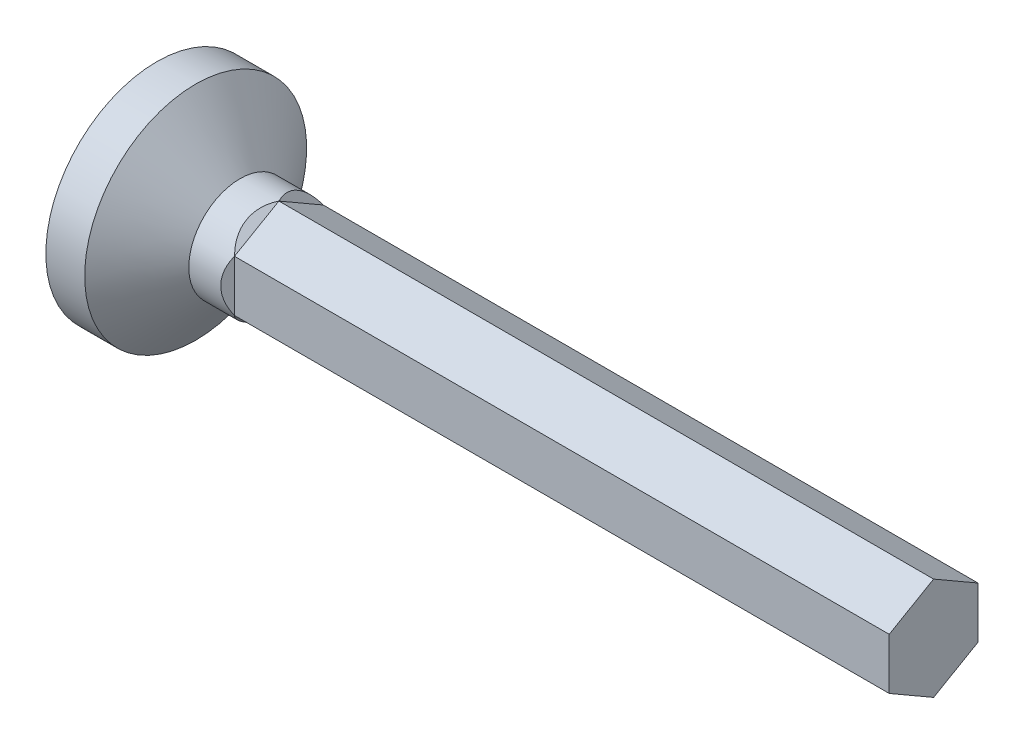
from build123d import *

# Parameters (mm, degrees)
BOSS_EXTRUDE1_DEPTH = 30
CHAMFER1_SIZE       = 0.5
CHAMFER2_SIZE       = 0.5
CHAMFER3_SIZE       = 0.5


with BuildPart() as part:
    # Sketch1 → Boss-Extrude1 (new body)
    with BuildSketch(Plane(origin=(0, 0, 0), x_dir=(0, 0, -1), z_dir=(1, 0, 0))):
        Polygon((0, 2.309401077), (-2, 1.154700538), (-2, -1.154700538), (0, -2.309401077), (2, -1.154700538), (2, 1.154700538), align=None)
    extrude(amount=BOSS_EXTRUDE1_DEPTH)

    # Sketch4 → Revolve4 (revolve)
    with BuildSketch(Plane.XY):
        Polygon((0, 0), (-5, 0), (-5, 5), (-3.25, 5), (-1.25, 2.309401077), (0, 2.309401077), align=None)
    revolve(axis=Axis((0, 0, 0), (-1, 0, 0)))

    # Chamfer1
    # the kernel refuses this chamfer: 0.5 mm, written as the material it adds along each edge
    with BuildSketch(Plane(origin=(0, -2.952321824, 1.113571399), x_dir=(0.9996219169112968, 0.02381212764409037, 0.013747938305293311), z_dir=(0, 0.5000000000000001, -0.8660254037844386))) as chamfer1_piece_1_section:
        Polygon((CHAMFER1_SIZE * 0.999621916911, CHAMFER1_SIZE * 0.0274958766106), (-CHAMFER1_SIZE * 0.0274958766106, CHAMFER1_SIZE * 0.999621916911), (0, 0), align=None)
    chamfer1_piece_1 = extrude(amount=4.881084065, mode=Mode.PRIVATE)
    chamfer1_piece_1 = split(chamfer1_piece_1, bisect_by=Plane(origin=(0.199770768, -1.81784162, -2), z_dir=(0, 0, 1)), keep=Keep.TOP, mode=Mode.PRIVATE)
    chamfer1_piece_1 = split(chamfer1_piece_1, bisect_by=Plane(origin=(0.199770768, -2.640971617, -0.574297023), z_dir=(0, 0.8660254037844387, -0.49999999999999983)), keep=Keep.TOP, mode=Mode.PRIVATE)
    chamfer1_piece_1 = chamfer1_piece_1 & Plane(origin=(0.199770768, 0, 0), x_dir=(0, 1, 0), z_dir=(1, 0, 0)) * Cylinder(2.309401077, 12, mode=Mode.PRIVATE)
    add(chamfer1_piece_1)
    with BuildSketch(Plane(origin=(0, 2.952321824, -1.113571399), x_dir=(0.9996219169112968, -0.023812127644089905, -0.013747938305293039), z_dir=(0, -0.5000000000000001, 0.8660254037844387))) as chamfer1_piece_2_section:
        Polygon((CHAMFER1_SIZE * 0.999621916911, CHAMFER1_SIZE * 0.0274958766106), (-CHAMFER1_SIZE * 0.0274958766106, CHAMFER1_SIZE * 0.999621916911), (0, 0), align=None)
    chamfer1_piece_2 = extrude(amount=4.881084065, mode=Mode.PRIVATE)
    chamfer1_piece_2 = split(chamfer1_piece_2, bisect_by=Plane(origin=(0.19977077, 2.640971618, 0.574297023), z_dir=(0, -0.8660254037844388, 0.49999999999999983)), keep=Keep.TOP, mode=Mode.PRIVATE)
    chamfer1_piece_2 = split(chamfer1_piece_2, bisect_by=Plane(origin=(0.19977077, 1.817841619, 2), z_dir=(0, 0, -1)), keep=Keep.TOP, mode=Mode.PRIVATE)
    chamfer1_piece_2 = chamfer1_piece_2 & Plane(origin=(0.19977077, 0, 0), x_dir=(0, 1, 0), z_dir=(1, 0, 0)) * Cylinder(2.309401077, 12, mode=Mode.PRIVATE)
    add(chamfer1_piece_2)

    # Chamfer2
    # the kernel refuses this chamfer: 0.5 mm, written as the material it adds along each edge
    with BuildSketch(Plane(origin=(0, -2.440542032, -2), x_dir=(0.9996219169112968, 0, 0.027495876610586494), z_dir=(0, 1, 0))) as chamfer2_piece_1_section:
        Polygon((CHAMFER2_SIZE * 0.999621916911, CHAMFER2_SIZE * 0.0274958766106), (-CHAMFER2_SIZE * 0.0274958766106, CHAMFER2_SIZE * 0.999621916911), (0, 0), align=None)
    chamfer2_piece_1 = extrude(amount=4.881084065, mode=Mode.PRIVATE)
    chamfer2_piece_1 = chamfer2_piece_1 & Plane(origin=(0.352657497, 0, 0), x_dir=(0, 1, 0), z_dir=(1, 0, 0)) * Cylinder(2.309401077, 12, mode=Mode.PRIVATE)
    chamfer2_piece_1 = split(chamfer2_piece_1, bisect_by=Plane(origin=(0.352657497, 0.578909499, -2.997299335), z_dir=(0, -0.8660254037844388, 0.49999999999999983)), keep=Keep.TOP, mode=Mode.PRIVATE)
    add(chamfer2_piece_1)
    with BuildSketch(Plane(origin=(0, 2.440542032, 2), x_dir=(0.9996219169112968, 0, -0.027495876610586494), z_dir=(0, -1, 0))) as chamfer2_piece_2_section:
        Polygon((CHAMFER2_SIZE * 0.999621916911, CHAMFER2_SIZE * 0.0274958766106), (-CHAMFER2_SIZE * 0.0274958766106, CHAMFER2_SIZE * 0.999621916911), (0, 0), align=None)
    chamfer2_piece_2 = extrude(amount=4.881084065, mode=Mode.PRIVATE)
    chamfer2_piece_2 = chamfer2_piece_2 & Plane(origin=(0.352657497, 0, 0), x_dir=(0, 1, 0), z_dir=(1, 0, 0)) * Cylinder(2.309401077, 12, mode=Mode.PRIVATE)
    chamfer2_piece_2 = split(chamfer2_piece_2, bisect_by=Plane(origin=(0.352657497, -0.578909499, 2.997299335), z_dir=(0, 0.8660254037844387, -0.49999999999999983)), keep=Keep.TOP, mode=Mode.PRIVATE)
    add(chamfer2_piece_2)

    # Chamfer3
    # the kernel refuses this chamfer: 0.5 mm, written as the material it adds along each edge
    with BuildSketch(Plane(origin=(0, 0.511779791, -3.113571399), x_dir=(-0.027495876610586466, 0.8656979742248804, -0.49981095845564816), z_dir=(0, 0.49999999999999983, 0.8660254037844388))) as chamfer3_piece_1_section:
        Polygon((CHAMFER3_SIZE * 0.999621916911, -CHAMFER3_SIZE * 0.0274958766106), (-CHAMFER3_SIZE * 0.0274958766106, -CHAMFER3_SIZE * 0.999621916911), (0, 0), align=None)
    chamfer3_piece_1 = extrude(amount=4.881084065, mode=Mode.PRIVATE)
    chamfer3_piece_1 = chamfer3_piece_1 & Plane(origin=(0.352657492, 0, 0), x_dir=(0, 1, 0), z_dir=(1, 0, 0)) * Cylinder(2.309401077, 12, mode=Mode.PRIVATE)
    add(chamfer3_piece_1)
    with BuildSketch(Plane(origin=(0, -0.511779791, 3.113571399), x_dir=(0.9996219169112968, 0.023812127644090055, -0.013747938305293115), z_dir=(0, -0.4999999999999999, -0.8660254037844388))) as chamfer3_piece_2_section:
        Polygon((CHAMFER3_SIZE * 0.999621916911, CHAMFER3_SIZE * 0.0274958766106), (-CHAMFER3_SIZE * 0.0274958766106, CHAMFER3_SIZE * 0.999621916911), (0, 0), align=None)
    chamfer3_piece_2 = extrude(amount=4.881084065, mode=Mode.PRIVATE)
    chamfer3_piece_2 = chamfer3_piece_2 & Plane(origin=(0.352657501, 0, 0), x_dir=(0, 1, 0), z_dir=(1, 0, 0)) * Cylinder(2.309401077, 12, mode=Mode.PRIVATE)
    add(chamfer3_piece_2)


solid = part.part
